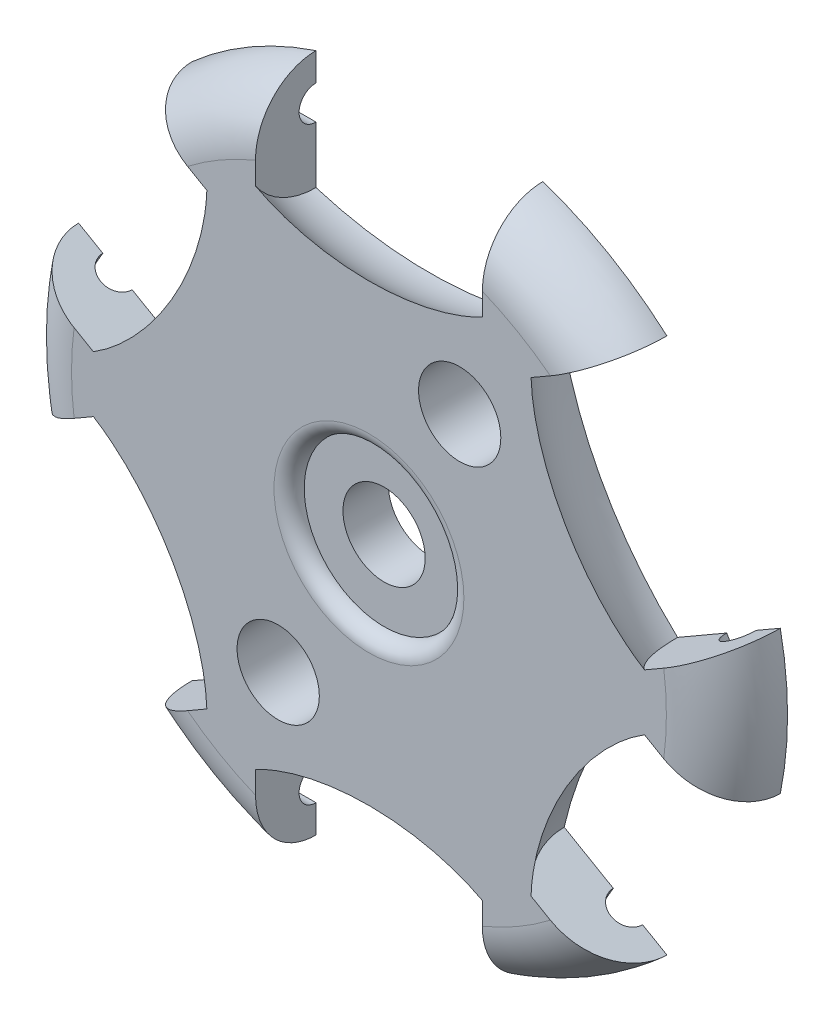
from build123d import *

# Parameters (mm, degrees)
SKETCH1_R           = 18.796
BOSS_EXTRUDE1_DEPTH = 3.175
FILLET1_R           = 3.18516
SKETCH2_R           = 2.159
CUT_EXTRUDE1_DEPTH  = 27.770480734
SKETCH6_R           = 0.889
CUT_EXTRUDE2_DEPTH  = 7.9375
CIRPATTERN1_COUNT   = 6
SKETCH9_R           = 4.191
CUT_EXTRUDE5_DEPTH  = 0.79375
FILLET2_R           = 0.79375


# Some blends are built 0.0001 mm under size
with BuildPart() as part:
    # Sketch1 → Boss-Extrude1 (new body)
    with BuildSketch(Plane.XY):
        Circle(SKETCH1_R)
    extrude(amount=BOSS_EXTRUDE1_DEPTH)

    # Fillet1
    # the kernel refuses this fillet: 3.18516 mm, written as the material it takes off along each edge
    with BuildSketch(Plane(origin=(0, 0, 3.175), x_dir=(1, 0, 0), z_dir=(0, -1, 0))) as fillet1_piece_1:
        with BuildLine():
            CenterArc((18.796 - FILLET1_R, -FILLET1_R), FILLET1_R, 0, 90)
            Line((18.796 - FILLET1_R, 0), (18.796, 0))
            Line((18.796, 0), (18.796, -FILLET1_R))
        make_face()
    revolve(axis=Axis((0, 0, 3.175), (0, 0, 1)), mode=Mode.SUBTRACT)

    # Sketch2 → Cut-Extrude1 (cut, through all)
    with BuildSketch(Plane.XY.offset(3.175)):
        with Locations((4.7625, 8.248891971)):
            Circle(SKETCH2_R)
        with Locations((-4.7625, -8.248891971)):
            Circle(SKETCH2_R)
        Circle(SKETCH2_R)
    extrude(amount=-CUT_EXTRUDE1_DEPTH, mode=Mode.SUBTRACT)

    # Sketch5 → Cut-Revolve1 (revolve, cut)
    with BuildSketch(Plane.XY):
        with BuildLine():
            Line((-5.953125, 15.4686), (5.953125, 15.4686))
            Line((5.953125, 15.4686), (5.953125, 19.335400434))
            ThreePointArc((5.953125, 19.335400434), (0, 20.2311), (-5.953125, 19.335400434))
            Line((-5.953125, 19.335400434), (-5.953125, 15.4686))
        make_face()
    cut_revolve1 = revolve(axis=Axis((-5.953125, 15.4686, 0), (-1, 0, 0)), mode=Mode.SUBTRACT)

    # Sketch6 → Cut-Extrude2 (cut, symmetric)
    with BuildSketch(Plane(origin=(0, 0, 0), x_dir=(0, 0, -1), z_dir=(1, 0, 0))):
        with Locations((0, 15.4686)):
            Circle(SKETCH6_R)
    cut_extrude2 = extrude(amount=CUT_EXTRUDE2_DEPTH, both=True, mode=Mode.SUBTRACT)

    # CirPattern1: Cut-Revolve1, Cut-Extrude2 ×6 about axis
    cirpattern1_axis = Axis((0, 0, 0), (0, 0, 1))
    add([cut_revolve1.rotate(cirpattern1_axis, i * 360 / CIRPATTERN1_COUNT) for i in range(1, CIRPATTERN1_COUNT)], mode=Mode.SUBTRACT)
    add([cut_extrude2.rotate(cirpattern1_axis, i * 360 / CIRPATTERN1_COUNT) for i in range(1, CIRPATTERN1_COUNT)], mode=Mode.SUBTRACT)

    # Sketch9 → Cut-Extrude5 (cut)
    with BuildSketch(Plane.XY.offset(3.175)):
        Circle(SKETCH9_R)
    extrude(amount=-CUT_EXTRUDE5_DEPTH, mode=Mode.SUBTRACT)

    # Fillet2
    fillet2_edges = [part.edges().sort_by_distance(p)[0] for p in [
        (-4.191, 0, 3.175),
    ]]
    fillet(fillet2_edges, radius=FILLET2_R - 0.0001)  # a hair under: the kernel refuses the full size


solid = part.part
